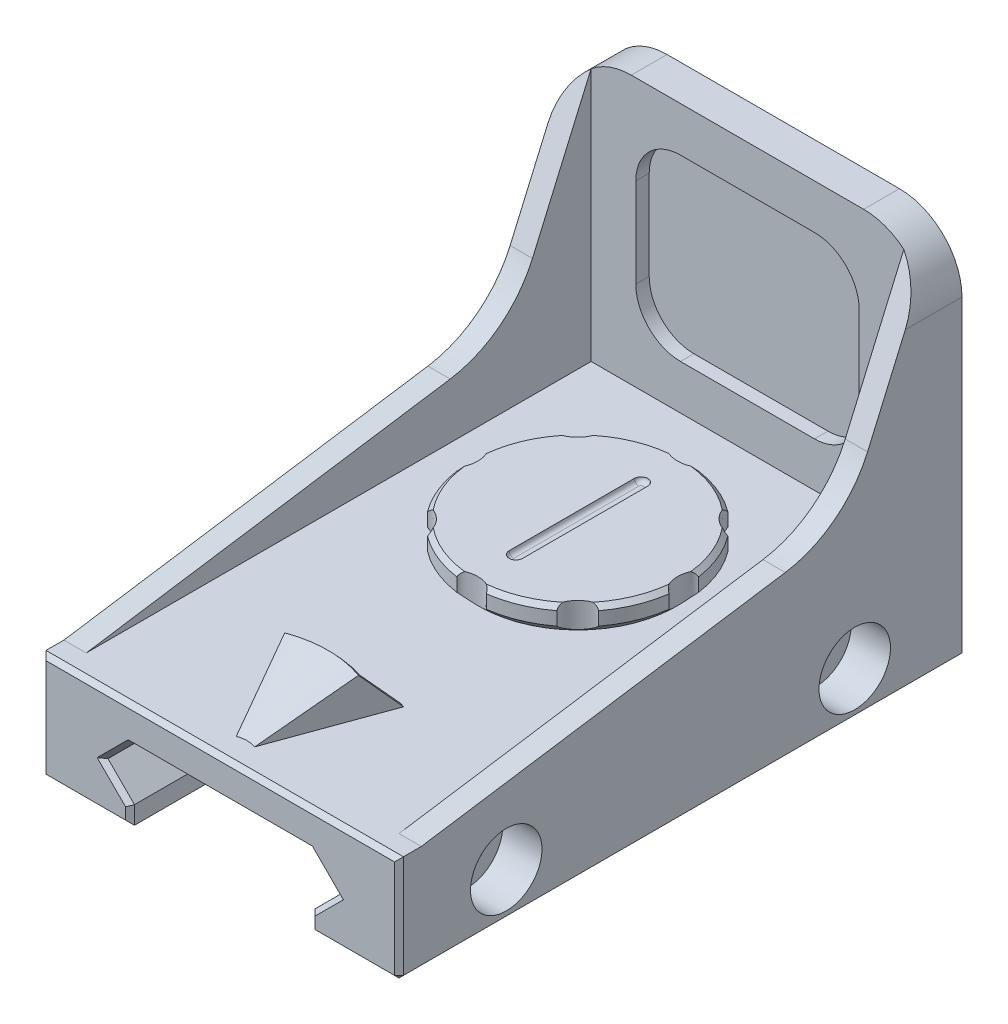
from build123d import *

# Parameters (mm, degrees)
SKIZZE1_W                         = 40
SKIZZE1_H                         = 12
AUFSATZ_LINEAR_AUSTRAGEN1_DEPTH   = 63
SCHNITT_LINEAR_START              = -63
SCHNITT_LINEAR_AUSTRAGEN2_DEPTH   = 63
ROTATION1_ANGLE                   = 20
ROTATION1_OTHER_WAY_ANGLE         = 20
SCHNITT_ROTATION1_ANGLE           = 18
SCHNITT_ROTATION1_OTHER_WAY_ANGLE = 18
SCHNITT_LINEAR_AUSTRAGEN3_DEPTH   = 3.2
LINEARES_MUSTER2_COUNT            = 2
LINEARES_MUSTER2_PITCH            = 39
AUFSATZ_LINEAR_AUSTRAGEN2_DEPTH   = 2.5
AUFSATZ_LINEAR_AUSTRAGEN3_REACH   = 96.062
SKIZZE15_W                        = 17.5
SKIZZE15_H                        = 4
SCHNITT_LINEAR_AUSTRAGEN4_DEPTH   = 93.925172827
SKIZZE18_W                        = 1
SKIZZE18_H                        = 0.455241794
VERRUNDUNG4_R                     = 12
AUFSATZ_LINEAR_AUSTRAGEN4_REACH   = 73.109
SKIZZE21_W                        = 1
SKIZZE21_H                        = 20.910483589
VERRUNDUNG4_OF_SPIEGELN8_R        = 12
VERRUNDUNG7_R                     = 7
FASE1_SIZE                        = 0.5
SKIZZE22_R                        = 12
AUFSATZ_LINEAR_AUSTRAGEN5_DEPTH   = 3
FASE2_SIZE                        = 0.5
FASE3_SIZE                        = 1
SKIZZE25_RX                       = 1.666624878
SKIZZE25_RY                       = 0.816084661
SCHNITT_LINEAR_AUSTRAGEN6_DEPTH   = 5
KREISMUSTER6_COUNT                = 8
SCHNITT_LINEAR_AUSTRAGEN7_DEPTH   = 0.5
VERRUNDUNG8_R                     = 0.5


# Read off the part's stored shape, not the designer's step: Schnitt-Linear austragen2
# Some blends are built 0.0001 mm under size
with BuildPart() as part:
    # Skizze1 → Aufsatz-Linear austragen1 (new body)
    with BuildSketch(Plane.XY):
        with Locations((-43.076191645, -20.219873998)):
            Rectangle(SKIZZE1_W, SKIZZE1_H)
    extrude(amount=AUFSATZ_LINEAR_AUSTRAGEN1_DEPTH)

    # Schnitt-Linear austragen2 outline → Schnitt-Linear austragen2 (cut)
    with BuildSketch(Plane(origin=(0, 0, 0), x_dir=(-1, 0, 0), z_dir=(0, 0, -1)).offset(SCHNITT_LINEAR_START)):
        Polygon((30.006343164, -21.250025517), (32.976191645, -24.219873998), (32.976191645, -26.219873998), (53.176191645, -26.219873998), (53.176191645, -24.219873998), (56.146040126, -21.250025517), (53.176191645, -18.280177036), (32.976191645, -18.280177036), align=None)
    extrude(amount=SCHNITT_LINEAR_AUSTRAGEN2_DEPTH, mode=Mode.SUBTRACT)

    # Skizze11 → Stirnsenkung für M3 (revolve, cut)
    with BuildSketch(Plane(origin=(-23.076191645, -21.219873998, 51), x_dir=(0, 0, -1), z_dir=(0, 1, 0))):
        Polygon((0, 0), (0, 40), (2.25, 40), (2.25, 4.4), (4, 4.4), (4, 0), align=None)
    stirnsenkung_f_r_m3 = revolve(axis=Axis((-16.726191645, -21.219873998, 51), (-1, 0, 0)), mode=Mode.SUBTRACT)

    # Skizze13 → Schnitt-Linear austragen3 (cut)
    with BuildSketch(Plane.ZY.offset(63.076191645)):
        Polygon((46.958548116, -21.219873998), (48.979274058, -24.719873998), (53.020725942, -24.719873998), (55.041451884, -21.219873998), (53.020725942, -17.719873998), (48.979274058, -17.719873998), align=None)
    schnitt_linear_austragen3 = extrude(amount=-SCHNITT_LINEAR_AUSTRAGEN3_DEPTH, mode=Mode.SUBTRACT)

    # Lineares Muster2: Stirnsenkung für M3, Schnitt-Linear austragen3 ×2
    with Locations(*[(0, 0, -i * LINEARES_MUSTER2_PITCH) for i in range(1, LINEARES_MUSTER2_COUNT)]):
        add(stirnsenkung_f_r_m3, mode=Mode.SUBTRACT)
        add(schnitt_linear_austragen3, mode=Mode.SUBTRACT)

    # Skizze14 → Aufsatz-Linear austragen2 (add)
    with BuildSketch(Plane(origin=(-23.076191645, 0, 0), x_dir=(0, 0, -1), z_dir=(1, 0, 0))):
        Polygon((0, -14.219873998), (0, 15.780126002), (-3.3, 15.780126002), (-13.208822223, -7.039220541), (-60.5, -14.219873998), align=None)
    aufsatz_linear_austragen2 = extrude(amount=-AUFSATZ_LINEAR_AUSTRAGEN2_DEPTH)

    # Aufsatz-Linear austragen3: up to this face of the body (flat: up to its plane)
    aufsatz_linear_austragen3_end = Plane(part.part.faces().sort_by_distance((-24.326191645, 15.780126002, 1.65))[0])
    # Skizze15 → Aufsatz-Linear austragen3 (add, up to the picked face)
    with BuildSketch(Plane(origin=(0, -14.219873998, 0), x_dir=(1, 0, 0), z_dir=(0, 1, 0)), mode=Mode.PRIVATE) as aufsatz_linear_austragen3_sk1:
        with Locations((-34.326191645, -2)):
            Rectangle(SKIZZE15_W, SKIZZE15_H)
    aufsatz_linear_austragen3_tool1 = split(extrude(aufsatz_linear_austragen3_sk1.sketch, amount=AUFSATZ_LINEAR_AUSTRAGEN3_REACH, mode=Mode.PRIVATE), bisect_by=aufsatz_linear_austragen3_end, keep=Keep.BOTH, mode=Mode.PRIVATE)
    aufsatz_linear_austragen3 = aufsatz_linear_austragen3_tool1.solids().sort_by(Axis((-34.326192, -14.219874, 2), (0, 1, 0)))[0]
    add(aufsatz_linear_austragen3)

    # Skizze16 → Schnitt-Linear austragen4 (cut, through all)
    with BuildSketch(Plane(origin=(0, 0, 0), x_dir=(-1, 0, 0), z_dir=(0, 0, -1))):
        with BuildLine():
            Line((43.076191645, 10.780126002), (35.576191645, 10.780126002))
            ThreePointArc((35.576191645, 10.780126002), (32.040657739, 9.315659908), (30.576191645, 5.780126002))
            Line((30.576191645, 5.780126002), (30.576191645, -4.219873998))
            ThreePointArc((30.576191645, -4.219873998), (32.040657739, -7.755407904), (35.576191645, -9.219873998))
            Line((35.576191645, -9.219873998), (43.076191645, -9.219873998))
            Line((43.076191645, -9.219873998), (43.076191645, 10.780126002))
        make_face()
    schnitt_linear_austragen4 = extrude(amount=-SCHNITT_LINEAR_AUSTRAGEN4_DEPTH, mode=Mode.SUBTRACT)

    # Schnitt-Austragung2: sweep along a curve in space
    with BuildLine() as schnitt_austragung2_path:
        Line((-43.076191645, -9.219873998, 4), (-35.576191645, -9.219873998, 4))
        ThreePointArc((-35.576191645, -9.219873998, 4), (-32.040657739, -7.755407904, 4), (-30.576191645, -4.219873998, 4))
        Line((-30.576191645, -4.219873998, 4), (-30.576191645, 5.780126002, 4))
        ThreePointArc((-30.576191645, 5.780126002, 4), (-32.040657739, 9.315659908, 4), (-35.576191645, 10.780126002, 4))
        Line((-35.576191645, 10.780126002, 4), (-43.076191645, 10.780126002, 4))
    # Skizze18 → Schnitt-Austragung2 (sweep, cut)
    with BuildSketch(Plane.ZY.offset(43.076191645)):
        with Locations((2, -9.447494895)):
            Rectangle(SKIZZE18_W, SKIZZE18_H)
    schnitt_austragung2 = sweep(path=schnitt_austragung2_path.line, mode=Mode.SUBTRACT)

    # Verrundung4
    verrundung4_edges = [part.edges().sort_by_distance(p)[0] for p in [
        (-24.326191645, -7.039220541, 13.208822223),
    ]]
    fillet(verrundung4_edges, radius=VERRUNDUNG4_R)

    # Skizze21 → Aufsatz-Linear austragen4 (add, up to next)
    with BuildSketch(Plane(origin=(-43.076191645, 0, 0), x_dir=(0, 0, -1), z_dir=(1, 0, 0)), mode=Mode.PRIVATE) as aufsatz_linear_austragen4_sk1:
        with Locations((-2, 0.780126003)):
            Rectangle(SKIZZE21_W, SKIZZE21_H)
    aufsatz_linear_austragen4_tool1 = extrude(aufsatz_linear_austragen4_sk1.sketch, amount=AUFSATZ_LINEAR_AUSTRAGEN4_REACH, mode=Mode.PRIVATE) - part.part
    aufsatz_linear_austragen4 = aufsatz_linear_austragen4_tool1.solids().sort_by_distance((-43.076192, 0.780126, 2))[0]
    add(aufsatz_linear_austragen4)

    # Spiegeln8: Aufsatz-Linear austragen2, Aufsatz-Linear austragen3, Schnitt-Linear austragen4, Schnitt-Austragung2 across plane
    add(aufsatz_linear_austragen2.mirror(Plane(origin=(-43.076191645, 0, 0), x_dir=(0, 0, 1), z_dir=(1, 0, 0))))
    add(aufsatz_linear_austragen3.mirror(Plane(origin=(-43.076191645, 0, 0), x_dir=(0, 0, 1), z_dir=(1, 0, 0))))
    add(schnitt_linear_austragen4.mirror(Plane(origin=(-43.076191645, 0, 0), x_dir=(0, 0, 1), z_dir=(1, 0, 0))), mode=Mode.SUBTRACT)
    add(schnitt_austragung2.mirror(Plane(origin=(-43.076191645, 0, 0), x_dir=(0, 0, 1), z_dir=(1, 0, 0))), mode=Mode.SUBTRACT)

    # Verrundung4 of Spiegeln8
    verrundung4_of_spiegeln8_edges = [part.edges().sort_by_distance(p)[0] for p in [
        (-61.826191645, -7.039220541, 13.208822223),
    ]]
    fillet(verrundung4_of_spiegeln8_edges, radius=VERRUNDUNG4_OF_SPIEGELN8_R)

    # Spiegeln10: Aufsatz-Linear austragen4 across plane
    add(aufsatz_linear_austragen4.mirror(Plane(origin=(-43.076191645, 0, 0), x_dir=(0, 0, 1), z_dir=(1, 0, 0))))

    # Verrundung7
    # the kernel refuses this fillet: 7 mm, written as the material it takes off along each edge
    with BuildSketch(Plane(origin=(-63.076191645, 15.780126002, -17.5), x_dir=(1, 0, 0), z_dir=(0, 0, 1))) as verrundung7_piece_1:
        with BuildLine():
            CenterArc((VERRUNDUNG7_R, -VERRUNDUNG7_R), VERRUNDUNG7_R, 90, 90)
            Line((0, -VERRUNDUNG7_R), (0, 0))
            Line((0, 0), (VERRUNDUNG7_R, 0))
        make_face()
    extrude(amount=38.3, mode=Mode.SUBTRACT)
    with BuildSketch(Plane(origin=(-23.076191645, 15.780126002, -17.5), x_dir=(-1, 0, 0), z_dir=(0, 0, 1))) as verrundung7_piece_2:
        with BuildLine():
            CenterArc((VERRUNDUNG7_R, VERRUNDUNG7_R), VERRUNDUNG7_R, 180, 90)
            Line((0, VERRUNDUNG7_R), (0, 0))
            Line((0, 0), (VERRUNDUNG7_R, 0))
        make_face()
    extrude(amount=38.3, mode=Mode.SUBTRACT)

    # Fase1
    fase1_edges = [part.edges().sort_by_distance(p)[0] for p in [
        (-58.126191645, -26.219873998, 63),
        (-63.076191645, -26.219873998, 31.5),
        (-63.076191645, -20.219873998, 63),
        (-43.076191645, -14.219873998, 63),
        (-28.026191645, -26.219873998, 63),
        (-23.076191645, -26.219873998, 31.5),
        (-23.076191645, -20.219873998, 63),
        (-43.076191645, -18.280177036, 63),
        (-43.076191645, -18.280177036, 0),
        (-32.976191645, -25.219873998, 63),
        (-53.176191645, -25.219873998, 63),
        (-32.976191645, -25.219873998, 0),
        (-53.176191645, -25.219873998, 0),
        (-58.126191645, -26.219873998, 0),
        (-28.026191645, -26.219873998, 0),
        (-31.491267405, -19.765101277, 63),
        (-31.491267405, -22.734949758, 63),
        (-54.661115886, -19.765101277, 63),
        (-54.661115886, -22.734949758, 63),
        (-54.661115886, -19.765101277, 0),
        (-54.661115886, -22.734949758, 0),
        (-31.491267405, -19.765101277, 0),
        (-31.491267405, -22.734949758, 0),
    ]]
    chamfer(fase1_edges, length=FASE1_SIZE)


with BuildPart() as body_2:
    # Skizze7 → Rotation1 (revolve)
    with BuildSketch(Plane(origin=(-43.076191645, 0, 0), x_dir=(0, 0, -1), z_dir=(1, 0, 0))):
        Polygon((-47, -14.219873998), (-50.93692213, -9.99369138), (-60, -14.219873998), align=None)
    revolve(axis=Axis((-43.076191645, -14.219873998, 63), (0, 1, 0)), revolution_arc=ROTATION1_ANGLE)

    # Skizze7 → Rotation1 other way (revolve)
    with BuildSketch(Plane(origin=(-43.076191645, 0, 0), x_dir=(0, 0, -1), z_dir=(1, 0, 0))):
        Polygon((-47, -14.219873998), (-50.93692213, -9.99369138), (-60, -14.219873998), align=None)
    revolve(axis=Axis((-43.076191645, -14.219873998, 63), (0, -1, 0)), revolution_arc=ROTATION1_OTHER_WAY_ANGLE)

    # Skizze10 → Schnitt-Rotation1 (revolve, cut)
    with BuildSketch(Plane(origin=(-43.076191645, 0, 0), x_dir=(0, 0, -1), z_dir=(1, 0, 0))):
        Polygon((-58.962787022, -14.219873998), (-49.194945396, -9.665054644), (-45.216852051, -14.219873998), align=None)
    revolve(axis=Axis((-43.076191645, -14.219873998, 63), (0, 1, 0)), revolution_arc=SCHNITT_ROTATION1_ANGLE, mode=Mode.SUBTRACT)

    # Skizze10 → Schnitt-Rotation1 other way (revolve, cut)
    with BuildSketch(Plane(origin=(-43.076191645, 0, 0), x_dir=(0, 0, -1), z_dir=(1, 0, 0))):
        Polygon((-58.962787022, -14.219873998), (-49.194945396, -9.665054644), (-45.216852051, -14.219873998), align=None)
    revolve(axis=Axis((-43.076191645, -14.219873998, 63), (0, -1, 0)), revolution_arc=SCHNITT_ROTATION1_OTHER_WAY_ANGLE, mode=Mode.SUBTRACT)


with BuildPart() as body_3:
    # Skizze22 → Aufsatz-Linear austragen5 (new body)
    with BuildSketch(Plane(origin=(0, -14.219873998, 0), x_dir=(1, 0, 0), z_dir=(0, 1, 0))):
        with Locations(Location((-43.076191645, -23, 0), (0, 0, 270))):
            Circle(SKIZZE22_R)
    extrude(amount=AUFSATZ_LINEAR_AUSTRAGEN5_DEPTH)

    # Fase2
    fase2_edges = [body_3.edges().sort_by_distance(p)[0] for p in [
        (-43.076191645, -11.219873998, 11),
    ]]
    chamfer(fase2_edges, length=FASE2_SIZE)

    # Fase3
    fase3_edges = [body_3.edges().sort_by_distance(p)[0] for p in [
        (-43.076191645, -14.219873998, 11),
    ]]
    chamfer(fase3_edges, length=FASE3_SIZE)

    # Skizze25 → Schnitt-Linear austragen6 (cut)
    with BuildSketch(Plane(origin=(0, -11.219873998, 0), x_dir=(1, 0, 0), z_dir=(0, 1, 0))):
        with Locations((-43.076191645, -35)):
            Ellipse(SKIZZE25_RX, SKIZZE25_RY)
    schnitt_linear_austragen6 = extrude(amount=-SCHNITT_LINEAR_AUSTRAGEN6_DEPTH, mode=Mode.SUBTRACT)

    # Kreismuster6: Schnitt-Linear austragen6 ×8 about axis
    kreismuster6_axis = Axis((-43.076191645, -11.719873998, 23), (0, 1, 0))
    for i in range(1, KREISMUSTER6_COUNT):
        add(schnitt_linear_austragen6.rotate(kreismuster6_axis, i * 360 / KREISMUSTER6_COUNT), mode=Mode.SUBTRACT)

    # Skizze26 → Schnitt-Linear austragen7 (cut)
    with BuildSketch(Plane(origin=(0, -11.219873998, 0), x_dir=(1, 0, 0), z_dir=(0, 1, 0))):
        with BuildLine():
            Line((-43.826191645, -29.916603942), (-43.826191645, -15.916603942))
            ThreePointArc((-43.826191645, -15.916603942), (-43.076191645, -15.166603942), (-42.326191645, -15.916603942))
            Line((-42.326191645, -15.916603942), (-42.326191645, -29.916603942))
            ThreePointArc((-42.326191645, -29.916603942), (-43.076191645, -30.666603942), (-43.826191645, -29.916603942))
        make_face()
    extrude(amount=-SCHNITT_LINEAR_AUSTRAGEN7_DEPTH, mode=Mode.SUBTRACT)

    # Verrundung8
    verrundung8_edges = [body_3.edges().sort_by_distance(p)[0] for p in [
        (-43.826191645, -11.719873998, 22.916603942),
        (-43.076191645, -11.719873998, 15.166603942),
        (-42.326191645, -11.719873998, 22.916603942),
        (-43.076191645, -11.719873998, 30.666603942),
    ]]
    fillet(verrundung8_edges, radius=VERRUNDUNG8_R - 0.0001)  # a hair under: the kernel refuses the full size


solid = Compound([part.part, body_2.part, body_3.part])
